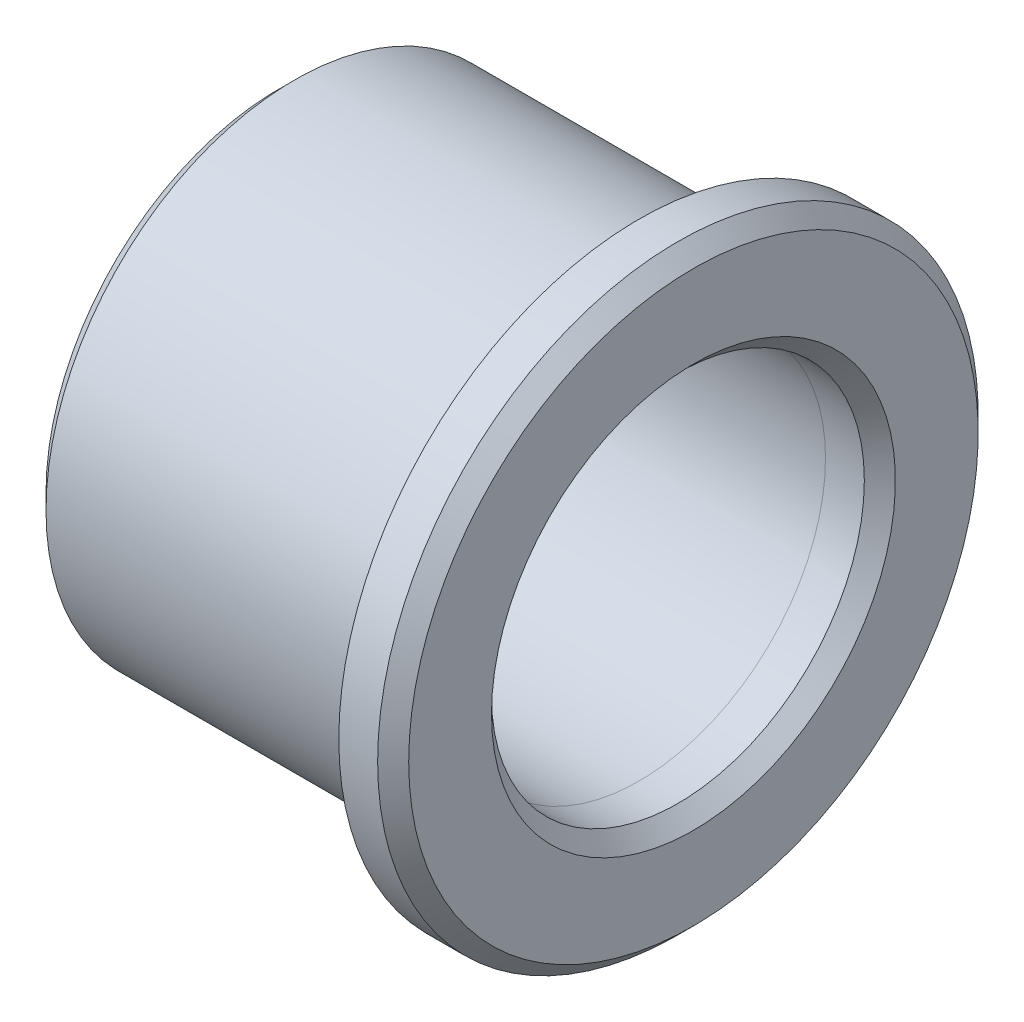
from build123d import *

# Parameters (mm, degrees)
CHANFREIN1_SIZE = 1


with BuildPart() as part:
    # Esquisse2 → Révolution1 (revolve)
    with BuildSketch(Plane.XY.offset(-154.849934573)):
        with BuildLine():
            Line((30.327079688, -158.823578252), (53.5, -158.823578252))
            Line((53.5, -158.823578252), (57, -158.823977934))
            Line((57, -158.823977934), (57, -151.496120175))
            Line((57, -151.496120175), (53.5, -151.496120175))
            Line((53.5, -151.496120175), (53.5, -154.400203651))
            ThreePointArc((53.5, -154.400203651), (53.557643476, -154.881621411), (53.076225717, -154.823977934))
            Line((53.076225717, -154.823977934), (30.327079688, -154.823977934))
            Line((30.327079688, -154.823977934), (30.327079688, -158.823578252))
        make_face()
    revolve(axis=Axis((16.895715824, -170.823977934, -154.849934573), (1, 0, 0)))

    # Chanfrein1
    chanfrein1_edges = [part.edges().sort_by_distance(p)[0] for p in [
        (57, -190.151835693, -154.849934573),
        (30.327079688, -182.824377617, -154.849934573),
        (57, -182.823977934, -154.849934573),
        (30.327079688, -186.823977934, -154.849934573),
    ]]
    chamfer(chanfrein1_edges, length=CHANFREIN1_SIZE)


solid = part.part
